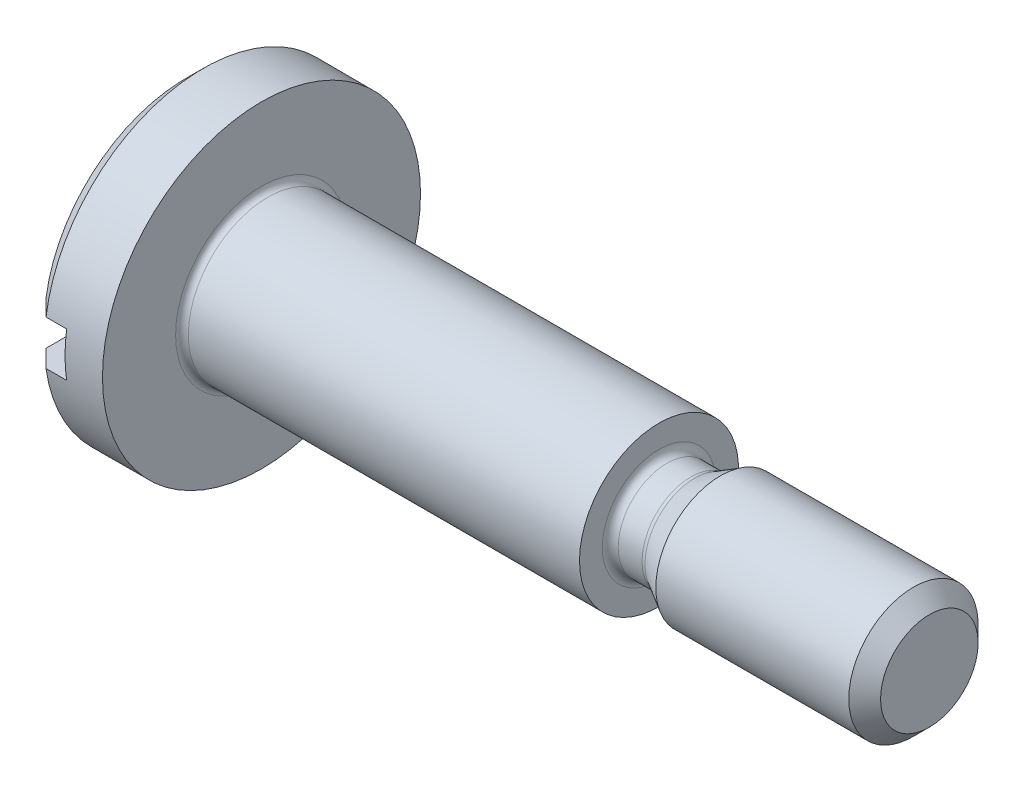
from build123d import *

# Parameters (mm, degrees)
FILLET1_R  = 0.4
SKETCH2_W  = 20
SKETCH2_H  = 2.8
SLOT_DEPTH = 2.4


with BuildPart() as part:
    # BodySke → Base-Revolve (revolve)
    with BuildSketch(Plane.XY):
        with BuildLine():
            Line((4.75, 5), (4.75, 10))
            Line((4.75, 10), (1.1, 10))
            Line((1.1, 10), (0, 8.9))
            Line((0, 8.9), (0, 0))
            Line((0, 0), (46.75, 0))
            Line((46.75, 0), (46.75, 3.066266942))
            Line((46.75, 3.066266942), (45.75, 4.066266942))
            Line((45.75, 4.066266942), (33.616025404, 4.066266942))
            Line((33.616025404, 4.066266942), (32, 3.133254241))
            ThreePointArc((32, 3.133254241), (31.879409523, 3.083304029), (31.75, 3.066266942))
            Line((31.75, 3.066266942), (30.25, 3.066266942))
            ThreePointArc((30.25, 3.066266942), (29.896446609, 3.212713552), (29.75, 3.566266942))
            Line((29.75, 3.566266942), (29.75, 5))
            Line((29.75, 5), (4.75, 5))
        make_face()
    revolve(axis=Axis((-25.4, 0, 0), (1, 0, 0)))

    # Fillet1
    fillet1_edges = [part.edges().sort_by_distance(p)[0] for p in [
        (4.75, -5, 0),
    ]]
    fillet(fillet1_edges, radius=FILLET1_R)

    # Sketch2 → Slot (cut)
    with BuildSketch(Plane(origin=(0, 0, 0), x_dir=(0, 0, -1), z_dir=(1, 0, 0))):
        Rectangle(SKETCH2_W, SKETCH2_H)
    extrude(amount=SLOT_DEPTH, mode=Mode.SUBTRACT)


solid = part.part
